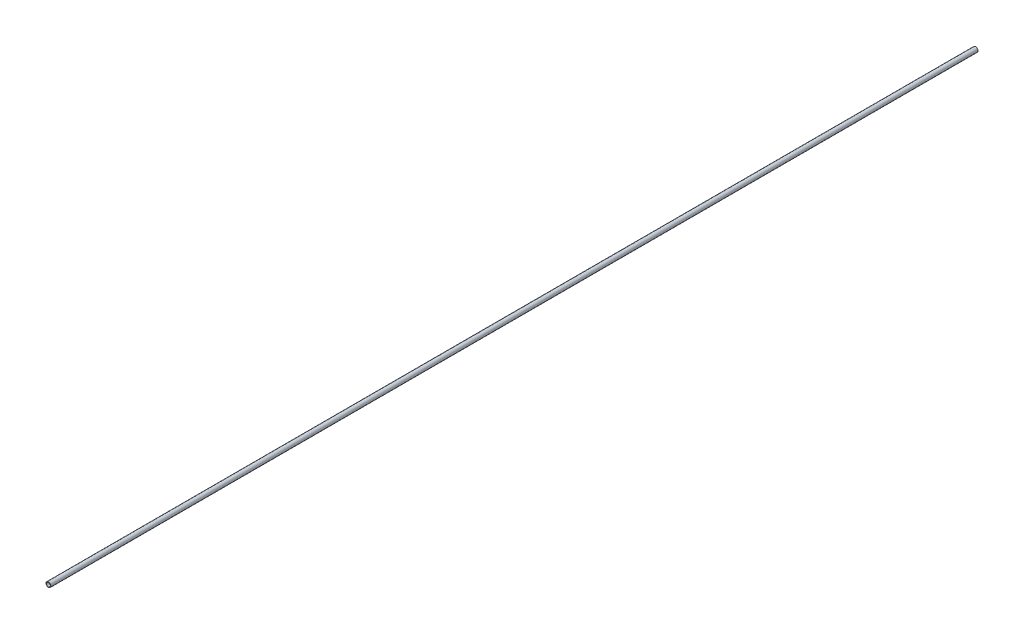
from build123d import *

# Parameters (mm, degrees)
SKETCH1_R      = 16.7005
SKETCH1_R_2    = 13.3223
BASEPIPE_DEPTH = 3213.1


with BuildPart() as part:
    # Sketch1 → BasePipe (new, symmetric)
    with BuildSketch(Plane.XY):
        Circle(SKETCH1_R)
        Circle(SKETCH1_R_2, mode=Mode.SUBTRACT)
    extrude(amount=BASEPIPE_DEPTH, both=True)


solid = part.part
